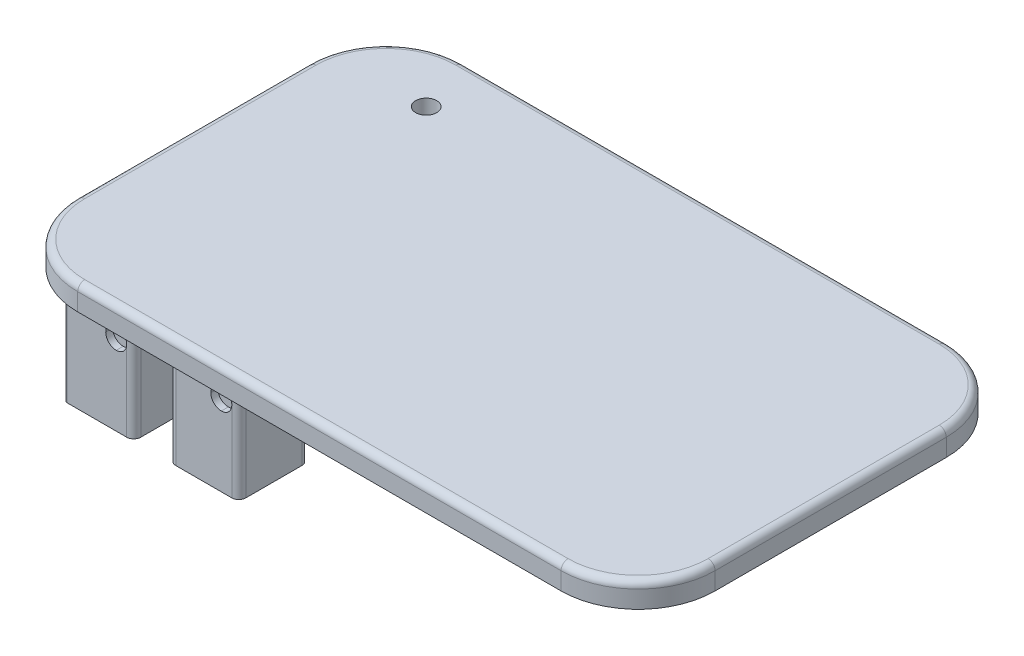
from build123d import *

# Parameters (mm, degrees)
SKETCH1_W              = 91
SKETCH1_H              = 55
BOSS_EXTRUDE1_DEPTH    = 3.5
FILLET1_R              = 11
BOSS_EXTRUDE2_START    = -3.5
SKETCH2_W              = 10
SKETCH2_H              = 10
SKETCH2_W_2            = 8
SKETCH2_H_2            = 8
SKETCH2_W_3            = 4
SKETCH2_H_3            = 4
BOSS_EXTRUDE2_DEPTH    = 13
CUT_EXTRUDE1_START     = -10
SKETCH3_W              = 1
SKETCH3_H              = 3
SKETCH3_W_2            = 3
SKETCH3_H_2            = 1
CUT_EXTRUDE1_DEPTH     = 3
FILLET2_R              = 1.4999
LPATTERN1_COUNT        = 2
LPATTERN1_PITCH        = 15
FILLET2_OF_LPATTERN1_R = 1.4999
FILLET3_R              = 0.5
SKETCH4_R              = 1.75
SKETCH4_R_2            = 0.75
BOSS_EXTRUDE3_DEPTH    = 1.5
CUT_EXTRUDE2_START     = -3
SKETCH4_2_R            = 0.75
CUT_EXTRUDE2_DEPTH     = 3
FILLET4_R              = 1
SKETCH5_R              = 1.5
CUT_EXTRUDE3_DEPTH     = 55.731161166
SKETCH6_W              = 25.4
SKETCH6_H              = 31.75
CUT_EXTRUDE4_DEPTH     = 3
FILLET5_R              = 0.5
FILLET6_R              = 1


with BuildPart() as part:
    # Sketch1 → Boss-Extrude1 (new body)
    with BuildSketch(Plane(origin=(0, 0, 0), x_dir=(1, 0, 0), z_dir=(0, 1, 0))):
        Rectangle(SKETCH1_W, SKETCH1_H)
    extrude(amount=BOSS_EXTRUDE1_DEPTH)

    # Fillet1
    fillet1_edges = [part.edges().sort_by_distance(p)[0] for p in [
        (-45.5, 1.75, -27.5),
        (45.5, 1.75, -27.5),
        (45.5, 1.75, 27.5),
        (-45.5, 1.75, 27.5),
    ]]
    fillet(fillet1_edges, radius=FILLET1_R)

    # Sketch2 → Boss-Extrude2 (add)
    # profile 1 of 2: a face of its own
    with BuildSketch(Plane(origin=(0, 3.5, 0), x_dir=(1, 0, 0), z_dir=(0, 1, 0)).offset(BOSS_EXTRUDE2_START)):
        with Locations((-32.5, -21.5)):
            Rectangle(SKETCH2_W, SKETCH2_H)
        with Locations((-32.5, -21.5)):
            Rectangle(SKETCH2_W_2, SKETCH2_H_2, mode=Mode.SUBTRACT)
    # profile 2 of 2: a face of its own
    with BuildSketch(Plane(origin=(0, 3.5, 0), x_dir=(1, 0, 0), z_dir=(0, 1, 0)).offset(BOSS_EXTRUDE2_START)):
        with Locations((-32.5, -21.5)):
            Rectangle(SKETCH2_W_3, SKETCH2_H_3)
    boss_extrude2 = extrude(amount=-BOSS_EXTRUDE2_DEPTH)

    # Sketch3 → Cut-Extrude1 (cut)
    with BuildSketch(Plane(origin=(0, -13, 0), x_dir=(-1, 0, 0), z_dir=(0, -1, 0)).offset(CUT_EXTRUDE1_START)):
        with Locations((37, -24)):
            Rectangle(SKETCH3_W, SKETCH3_H)
        with Locations((30, -26)):
            Rectangle(SKETCH3_W_2, SKETCH3_H_2)
    cut_extrude1 = extrude(amount=-CUT_EXTRUDE1_DEPTH, mode=Mode.SUBTRACT)

    # Fillet2
    fillet2_edges = [part.edges().sort_by_distance(p)[0] for p in [
        (-28.5, 0, 22),
        (-37, -3, 25.5),
        (-37, -3, 22.5),
        (-31.5, 0, 26),
        (-31.5, -3, 26),
        (-28.5, -3, 26),
    ]]
    fillet(fillet2_edges, radius=FILLET2_R)

    # LPattern1: Boss-Extrude2, Cut-Extrude1 ×2
    with Locations(*[(i * LPATTERN1_PITCH, 0, 0) for i in range(1, LPATTERN1_COUNT)]):
        add(boss_extrude2)
        add(cut_extrude1, mode=Mode.SUBTRACT)

    # Fillet2 of LPattern1
    fillet2_of_lpattern1_edges = [part.edges().sort_by_distance(p)[0] for p in [
        (-13.5, 0, 22),
        (-22, -3, 25.5),
        (-22, -3, 22.5),
        (-16.5, 0, 26),
        (-16.5, -3, 26),
        (-13.5, -3, 26),
    ]]
    fillet(fillet2_of_lpattern1_edges, radius=FILLET2_OF_LPATTERN1_R)

    # Fillet3
    fillet3_edges = [part.edges().sort_by_distance(p)[0] for p in [
        (-37.5, -6.5, 26.5),
    ]]
    fillet(fillet3_edges, radius=FILLET3_R)

    # Sketch4 → Boss-Extrude3 (add)
    # profile 1 of 4: a face of its own
    with BuildSketch(Plane.XZ):
        with Locations(Location((34.64, 1.61, 0), (0, 0, 270))):
            Circle(SKETCH4_R)
        with Locations(Location((34.64, 1.61, 0), (0, 0, 270))):
            Circle(SKETCH4_R_2, mode=Mode.SUBTRACT)
    # profile 2 of 4: a face of its own
    with BuildSketch(Plane.XZ):
        with Locations(Location((34.64, 17.51, 0), (0, 0, 270))):
            Circle(SKETCH4_R)
        with Locations(Location((34.64, 17.51, 0), (0, 0, 270))):
            Circle(SKETCH4_R_2, mode=Mode.SUBTRACT)
    # profile 3 of 4: a face of its own
    with BuildSketch(Plane.XZ):
        with Locations(Location((-6.86, 17.51, 0), (0, 0, 270))):
            Circle(SKETCH4_R)
        with Locations(Location((-6.86, 17.51, 0), (0, 0, 270))):
            Circle(SKETCH4_R_2, mode=Mode.SUBTRACT)
    # profile 4 of 4: a face of its own
    with BuildSketch(Plane.XZ):
        with Locations(Location((-6.86, 1.61, 0), (0, 0, 270))):
            Circle(SKETCH4_R)
        with Locations(Location((-6.86, 1.61, 0), (0, 0, 270))):
            Circle(SKETCH4_R_2, mode=Mode.SUBTRACT)
    extrude(amount=BOSS_EXTRUDE3_DEPTH)

    # Sketch4<2> → Cut-Extrude2 (cut)
    with BuildSketch(Plane.XZ.offset(CUT_EXTRUDE2_START)):
        with Locations(Location((-6.86, 1.61, 0), (0, 0, 270))):
            Circle(SKETCH4_2_R)
        with Locations(Location((-6.86, 17.51, 0), (0, 0, 270))):
            Circle(SKETCH4_2_R)
        with Locations(Location((34.64, 17.51, 0), (0, 0, 270))):
            Circle(SKETCH4_2_R)
        with Locations(Location((34.64, 1.61, 0), (0, 0, 270))):
            Circle(SKETCH4_2_R)
    extrude(amount=CUT_EXTRUDE2_DEPTH, mode=Mode.SUBTRACT)

    # Fillet4
    fillet4_edges = [part.edges().sort_by_distance(p)[0] for p in [
        (-33.24995, 0, 17.5),
        (-28.939310539, -0.439310539, 17.5),
        (-12.5, -6.5, 26.5),
        (-22.5, -6.5, 26.5),
        (-22.5, -6.5, 16.5),
        (-12.5, -6.5, 16.5),
        (-21.5, -6.5, 17.5),
        (-13.5, -7.24995, 17.5),
        (-13.5, -7.25005, 25.5),
        (-21.5, -7.25005, 25.5),
        (-19.5, -6.5, 23.5),
        (-19.5, -6.5, 19.5),
        (-15.5, -6.5, 19.5),
        (-15.5, -6.5, 23.5),
        (-18.24995, 0, 17.5),
        (-13.939310539, -0.439310539, 17.5),
        (-27.5, -6.5, 26.5),
        (-37.5, -6.5, 16.5),
        (-27.5, -6.5, 16.5),
        (-36.5, -6.5, 17.5),
        (-28.5, -7.24995, 17.5),
        (-28.5, -7.25005, 25.5),
        (-36.5, -7.25005, 25.5),
        (-34.5, -6.5, 23.5),
        (-34.5, -6.5, 19.5),
        (-30.5, -6.5, 19.5),
        (-30.5, -6.5, 23.5),
    ]]
    fillet(fillet4_edges, radius=FILLET4_R - 0.0001)  # a hair under: the kernel refuses the full size

    # Sketch5 → Cut-Extrude3 (cut, through all)
    with BuildSketch(Plane.XZ):
        with Locations(Location((-31.5, -19.25, 0), (0, 0, 270))):
            Circle(SKETCH5_R)
    extrude(amount=-CUT_EXTRUDE3_DEPTH, mode=Mode.SUBTRACT)

    # Sketch6 → Cut-Extrude4 (cut)
    with BuildSketch(Plane.XZ):
        with Locations((-25.2, -0.864526382)):
            Rectangle(SKETCH6_W, SKETCH6_H)
    extrude(amount=-CUT_EXTRUDE4_DEPTH, mode=Mode.SUBTRACT)

    # Fillet5
    fillet5_edges = [part.edges().sort_by_distance(p)[0] for p in [
        (-37.9, 3, -0.864526382),
        (-25.2, 3, 15.010473618),
        (-12.5, 3, -0.864526382),
        (-25.2, 3, -16.739526382),
    ]]
    fillet(fillet5_edges, radius=FILLET5_R)

    # Fillet6
    fillet6_edges = [part.edges().sort_by_distance(p)[0] for p in [
        (0, 3.5, 27.5),
        (-45.5, 3.5, 0),
        (45.5, 3.5, 0),
        (0, 3.5, -27.5),
        (42.278174593, 3.5, 24.278174593),
        (42.278174593, 3.5, -24.278174593),
        (-42.278174593, 3.5, -24.278174593),
        (-42.278174593, 3.5, 24.278174593),
    ]]
    fillet(fillet6_edges, radius=FILLET6_R)


solid = part.part
